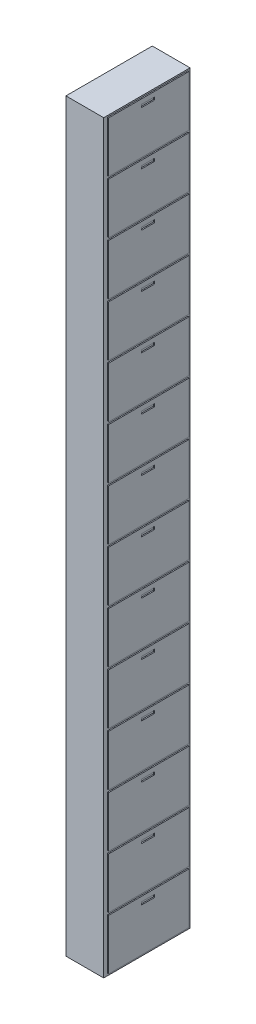
from build123d import *

# Parameters (mm, degrees)
SKETCH1_W           = 350
SKETCH1_H           = 6900
BOSS_EXTRUDE1_DEPTH = 800
SKETCH3_W           = 743.632052548
SKETCH3_H           = 470
SKETCH3_W_2         = 121.072841775
SKETCH3_H_2         = 25.802408902
BOSS_EXTRUDE3_DEPTH = 10


with BuildPart() as part:
    # Sketch1 → Boss-Extrude1 (new body)
    with BuildSketch(Plane.XY):
        with Locations((38.061970043, 729.986327315)):
            Rectangle(SKETCH1_W, SKETCH1_H)
    extrude(amount=BOSS_EXTRUDE1_DEPTH)

    # Sketch3 → Boss-Extrude3 (add)
    # profile 1 of 14: a face of its own
    with BuildSketch(Plane(origin=(213.061970043, 0, 0), x_dir=(0, 0, -1), z_dir=(1, 0, 0))):
        with Locations((-391.816026274, -2465.013672685)):
            Rectangle(SKETCH3_W, SKETCH3_H)
        with Locations((-401.128332344, -2287.011976611)):
            Rectangle(SKETCH3_W_2, SKETCH3_H_2, mode=Mode.SUBTRACT)
    # profile 2 of 14: a face of its own
    with BuildSketch(Plane(origin=(213.061970043, 0, 0), x_dir=(0, 0, -1), z_dir=(1, 0, 0))):
        with Locations((-391.816026274, -1973.013672685)):
            Rectangle(SKETCH3_W, SKETCH3_H)
        with Locations((-401.128332344, -1795.011976611)):
            Rectangle(SKETCH3_W_2, SKETCH3_H_2, mode=Mode.SUBTRACT)
    # profile 3 of 14: a face of its own
    with BuildSketch(Plane(origin=(213.061970043, 0, 0), x_dir=(0, 0, -1), z_dir=(1, 0, 0))):
        with Locations((-391.816026274, -1481.013672685)):
            Rectangle(SKETCH3_W, SKETCH3_H)
        with Locations((-401.128332344, -1303.011976611)):
            Rectangle(SKETCH3_W_2, SKETCH3_H_2, mode=Mode.SUBTRACT)
    # profile 4 of 14: a face of its own
    with BuildSketch(Plane(origin=(213.061970043, 0, 0), x_dir=(0, 0, -1), z_dir=(1, 0, 0))):
        with Locations((-391.816026274, -989.013672685)):
            Rectangle(SKETCH3_W, SKETCH3_H)
        with Locations((-401.128332344, -811.011976611)):
            Rectangle(SKETCH3_W_2, SKETCH3_H_2, mode=Mode.SUBTRACT)
    # profile 5 of 14: a face of its own
    with BuildSketch(Plane(origin=(213.061970043, 0, 0), x_dir=(0, 0, -1), z_dir=(1, 0, 0))):
        with Locations((-391.816026274, -497.013672685)):
            Rectangle(SKETCH3_W, SKETCH3_H)
        with Locations((-401.128332344, -319.011976611)):
            Rectangle(SKETCH3_W_2, SKETCH3_H_2, mode=Mode.SUBTRACT)
    # profile 6 of 14: a face of its own
    with BuildSketch(Plane(origin=(213.061970043, 0, 0), x_dir=(0, 0, -1), z_dir=(1, 0, 0))):
        with Locations((-391.816026274, -5.013672685)):
            Rectangle(SKETCH3_W, SKETCH3_H)
        with Locations((-401.128332344, 172.988023389)):
            Rectangle(SKETCH3_W_2, SKETCH3_H_2, mode=Mode.SUBTRACT)
    # profile 7 of 14: a face of its own
    with BuildSketch(Plane(origin=(213.061970043, 0, 0), x_dir=(0, 0, -1), z_dir=(1, 0, 0))):
        with Locations((-391.816026274, 486.986327315)):
            Rectangle(SKETCH3_W, SKETCH3_H)
        with Locations((-401.128332344, 664.988023389)):
            Rectangle(SKETCH3_W_2, SKETCH3_H_2, mode=Mode.SUBTRACT)
    # profile 8 of 14: a face of its own
    with BuildSketch(Plane(origin=(213.061970043, 0, 0), x_dir=(0, 0, -1), z_dir=(1, 0, 0))):
        with Locations((-391.816026274, 978.986327315)):
            Rectangle(SKETCH3_W, SKETCH3_H)
        with Locations((-401.128332344, 1156.988023389)):
            Rectangle(SKETCH3_W_2, SKETCH3_H_2, mode=Mode.SUBTRACT)
    # profile 9 of 14: a face of its own
    with BuildSketch(Plane(origin=(213.061970043, 0, 0), x_dir=(0, 0, -1), z_dir=(1, 0, 0))):
        with Locations((-391.816026274, 1470.986327315)):
            Rectangle(SKETCH3_W, SKETCH3_H)
        with Locations((-401.128332344, 1648.988023389)):
            Rectangle(SKETCH3_W_2, SKETCH3_H_2, mode=Mode.SUBTRACT)
    # profile 10 of 14: a face of its own
    with BuildSketch(Plane(origin=(213.061970043, 0, 0), x_dir=(0, 0, -1), z_dir=(1, 0, 0))):
        with Locations((-391.816026274, 1962.986327315)):
            Rectangle(SKETCH3_W, SKETCH3_H)
        with Locations((-401.128332344, 2140.988023389)):
            Rectangle(SKETCH3_W_2, SKETCH3_H_2, mode=Mode.SUBTRACT)
    # profile 11 of 14: a face of its own
    with BuildSketch(Plane(origin=(213.061970043, 0, 0), x_dir=(0, 0, -1), z_dir=(1, 0, 0))):
        with Locations((-391.816026274, 2454.986327315)):
            Rectangle(SKETCH3_W, SKETCH3_H)
        with Locations((-401.128332344, 2632.988023389)):
            Rectangle(SKETCH3_W_2, SKETCH3_H_2, mode=Mode.SUBTRACT)
    # profile 12 of 14: a face of its own
    with BuildSketch(Plane(origin=(213.061970043, 0, 0), x_dir=(0, 0, -1), z_dir=(1, 0, 0))):
        with Locations((-391.816026274, 2946.986327315)):
            Rectangle(SKETCH3_W, SKETCH3_H)
        with Locations((-401.128332344, 3124.988023389)):
            Rectangle(SKETCH3_W_2, SKETCH3_H_2, mode=Mode.SUBTRACT)
    # profile 13 of 14: a face of its own
    with BuildSketch(Plane(origin=(213.061970043, 0, 0), x_dir=(0, 0, -1), z_dir=(1, 0, 0))):
        with Locations((-391.816026274, 3438.986327315)):
            Rectangle(SKETCH3_W, SKETCH3_H)
        with Locations((-401.128332344, 3616.988023389)):
            Rectangle(SKETCH3_W_2, SKETCH3_H_2, mode=Mode.SUBTRACT)
    # profile 14 of 14: a face of its own
    with BuildSketch(Plane(origin=(213.061970043, 0, 0), x_dir=(0, 0, -1), z_dir=(1, 0, 0))):
        with Locations((-391.816026274, 3930.986327315)):
            Rectangle(SKETCH3_W, SKETCH3_H)
        with Locations((-401.128332344, 4108.988023389)):
            Rectangle(SKETCH3_W_2, SKETCH3_H_2, mode=Mode.SUBTRACT)
    extrude(amount=BOSS_EXTRUDE3_DEPTH)


solid = part.part
